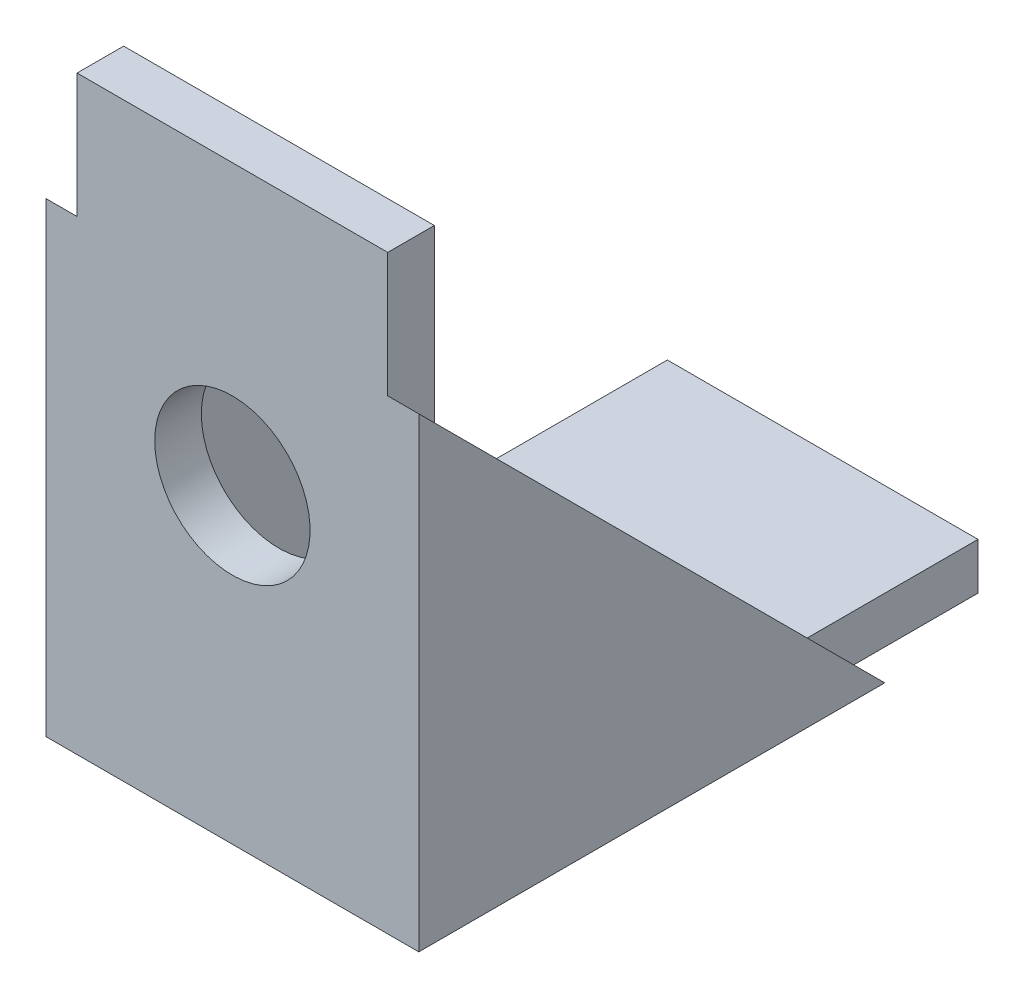
from build123d import *

# Parameters (mm, degrees)
EXTRUDE_1_DEPTH     = 20
SKETCH_3_R          = 1.5
CUT_EXTRUDE_1_DEPTH = 56.398555938
SKETCH_5_R          = 5
CUT_EXTRUDE_3_DEPTH = 56.398555938
EXTRUDE_2_DEPTH     = 2
EXTRUDE_3_DEPTH     = 2


with BuildPart() as part:
    # 草图1 → 凸台-拉伸1 (new body)
    with BuildSketch(Plane(origin=(0, 0, 0), x_dir=(0, 0, -1), z_dir=(1, 0, 0))):
        Polygon((0, 0), (0, 38), (3, 38), (3, 3), (38, 3), (38, 0), align=None)
    extrude(amount=EXTRUDE_1_DEPTH)

    # 草图3 → 切除-拉伸1 (cut, through all)
    with BuildSketch(Plane(origin=(0, 3, 0), x_dir=(1, 0, 0), z_dir=(0, 1, 0))):
        with Locations((16, 12)):
            Circle(SKETCH_3_R)
        with Locations((4, 12)):
            Circle(SKETCH_3_R)
        with Locations((4, 24)):
            Circle(SKETCH_3_R)
        with Locations((16, 24)):
            Circle(SKETCH_3_R)
    extrude(amount=-CUT_EXTRUDE_1_DEPTH, mode=Mode.SUBTRACT)

    # 草图5 → 切除-拉伸3 (cut, through all)
    with BuildSketch(Plane(origin=(0, 0, -3), x_dir=(-1, 0, 0), z_dir=(0, 0, -1))):
        with Locations((-10, 20)):
            Circle(SKETCH_5_R)
    extrude(amount=-CUT_EXTRUDE_3_DEPTH, mode=Mode.SUBTRACT)

    # 草图6 → 凸台-拉伸2 (add)
    with BuildSketch(Plane.ZY):
        Polygon((0, 0), (0, 30), (-30, 0), align=None)
    extrude(amount=EXTRUDE_2_DEPTH)

    # 草图7 → 凸台-拉伸3 (add)
    with BuildSketch(Plane(origin=(20, 0, 0), x_dir=(0, 0, -1), z_dir=(1, 0, 0))):
        Polygon((0, 0), (0, 30), (30, 0), align=None)
    extrude(amount=EXTRUDE_3_DEPTH)


solid = part.part
